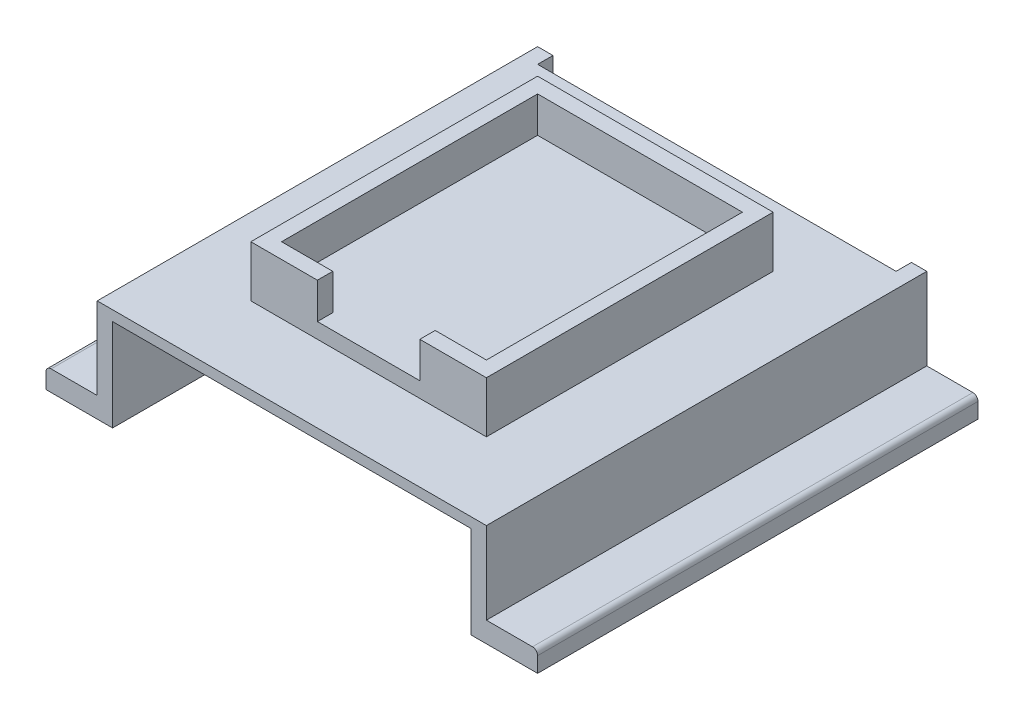
from build123d import *

# Parameters (mm, degrees)
SKETCH1_W             = 23
SKETCH1_H             = 28
SKETCH1_W_2           = 20
SKETCH1_H_2           = 25
BOSS_EXTRUDE1_DEPTH   = 5
SKETCH1_3_W           = 20
SKETCH1_3_H           = 25
BOSS_EXTRUDE2_DEPTH   = 1.5
SKETCH3_W             = 10
SKETCH3_H             = 3.5
CUT_EXTRUDE1_DEPTH    = 5
SKETCH4_W             = 1.5
SKETCH4_H             = 43
BOSS_EXTRUDE3_DEPTH   = 10
BOSS_EXTRUDE3_2_DEPTH = 10
SKETCH4_4_W           = 35
SKETCH4_4_H           = 41.5
BOSS_EXTRUDE4_DEPTH   = 1
SKETCH5_W             = 43
SKETCH5_H             = 2
BOSS_EXTRUDE5_DEPTH   = 5
FILLET1_R             = 0.5


with BuildPart() as part:
    # Sketch1 → Boss-Extrude1 (new body)
    with BuildSketch(Plane(origin=(0, 0, 0), x_dir=(1, 0, 0), z_dir=(0, 1, 0))):
        Rectangle(SKETCH1_W, SKETCH1_H)
        Rectangle(SKETCH1_W_2, SKETCH1_H_2, mode=Mode.SUBTRACT)
    extrude(amount=BOSS_EXTRUDE1_DEPTH)

    # Sketch1<3> → Boss-Extrude2 (add)
    with BuildSketch(Plane(origin=(0, 0, 0), x_dir=(1, 0, 0), z_dir=(0, 1, 0))):
        Rectangle(SKETCH1_3_W, SKETCH1_3_H)
    extrude(amount=BOSS_EXTRUDE2_DEPTH)

    # Sketch3 → Cut-Extrude1 (cut)
    with BuildSketch(Plane.XY.offset(14)):
        with Locations((0, 3.25)):
            Rectangle(SKETCH3_W, SKETCH3_H)
    extrude(amount=-CUT_EXTRUDE1_DEPTH, mode=Mode.SUBTRACT)



with BuildPart() as body_2:
    # Sketch4 → Boss-Extrude3 (new body)
    with BuildSketch(Plane.XZ):
        with Locations((18.25, 0)):
            Rectangle(SKETCH4_W, SKETCH4_H)
    extrude(amount=BOSS_EXTRUDE3_DEPTH)


with BuildPart() as body_3:
    # Sketch4 → Boss-Extrude3 2 (new body)
    with BuildSketch(Plane.XZ):
        with Locations((-18.25, 0)):
            Rectangle(SKETCH4_W, SKETCH4_H)
    extrude(amount=BOSS_EXTRUDE3_2_DEPTH)


with BuildPart() as part_1:
    add(part.part)

    add(body_2.part)  # Boss-Extrude4 merges body 2

    add(body_3.part)  # Boss-Extrude4 merges body 3
    # Sketch4<4> → Boss-Extrude4 (add)
    with BuildSketch(Plane.XZ):
        with Locations((0, 0.75)):
            Rectangle(SKETCH4_4_W, SKETCH4_4_H)
    extrude(amount=BOSS_EXTRUDE4_DEPTH)

    # Sketch5 → Boss-Extrude5 (add)
    with BuildSketch(Plane.ZY.offset(19)):
        with Locations((0, -9)):
            Rectangle(SKETCH5_W, SKETCH5_H)
    boss_extrude5 = extrude(amount=BOSS_EXTRUDE5_DEPTH)

    # Mirror1: Boss-Extrude5 across plane
    add(boss_extrude5.mirror(Plane(origin=(0, 0, 0), x_dir=(0, 0, 1), z_dir=(1, 0, 0))))

    # Fillet1
    fillet1_edges = [part_1.edges().sort_by_distance(p)[0] for p in [
        (24, -8, 0),
        (-24, -8, 0),
    ]]
    fillet(fillet1_edges, radius=FILLET1_R)


solid = part_1.part
